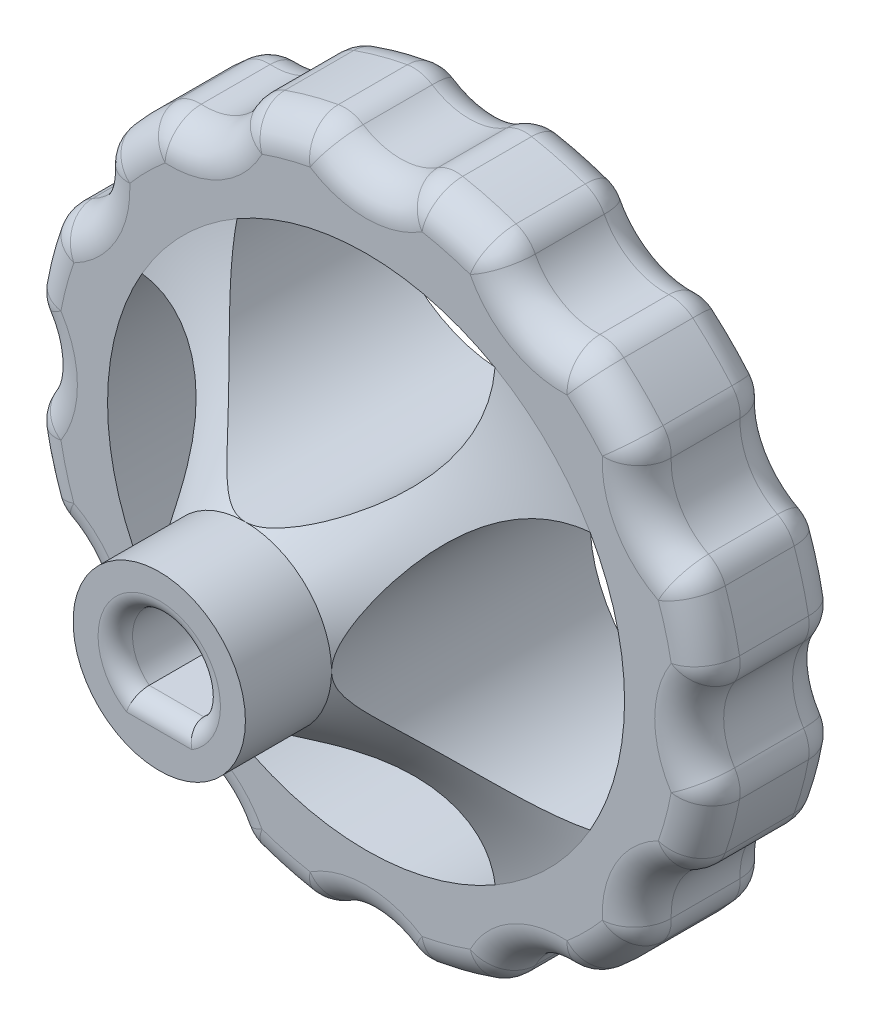
from build123d import *

# Parameters (mm, degrees)
CUT_EXTRUDE1_DEPTH = 35.641016151
CIRPATTERN1_COUNT  = 4
CUT_EXTRUDE3_DEPTH = 10
SKETCH7_R          = 4
CUT_EXTRUDE2_DEPTH = 35.641016151
CIRPATTERN2_COUNT  = 12
FILLET1_R          = 2
FILLET2_R          = 2
FILLET3_R          = 1


with BuildPart() as part:
    # Sketch1 → Revolve3 (revolve)
    with BuildSketch(Plane(origin=(0, 0, 0), x_dir=(0, 0, -1), z_dir=(1, 0, 0)), mode=Mode.PRIVATE) as revolve3_sk:
        with BuildLine():
            Line((0, 0), (0, 5))
            Line((0, 5), (5, 5))
            ThreePointArc((5, 5), (9.563207702, 9.255754609), (12, 15))
            Line((12, 15), (12, 20))
            Line((12, 20), (20, 20))
            Line((20, 20), (20, 0))
            Line((20, 0), (0, 0))
        make_face()
    revolve(revolve3_sk.sketch.rotate(Axis((0, 0, 0), (0, 0, -1)), 90), axis=Axis((0, 0, 0), (0, 0, -1)))

    # Sketch5 → Cut-Extrude1 (cut, through all)
    with BuildSketch(Plane(origin=(0, 0, -20), x_dir=(-1, 0, 0), z_dir=(0, 0, -1))):
        with BuildLine():
            ThreePointArc((7.483314774, 13), (0, 15), (-7.483314774, 13))
            ThreePointArc((-7.483314774, 13), (0, 5), (7.483314774, 13))
        make_face()
    cut_extrude1 = extrude(amount=-CUT_EXTRUDE1_DEPTH, mode=Mode.SUBTRACT)

    # CirPattern1: Cut-Extrude1 ×4 about axis
    cirpattern1_axis = Axis((0, 0, 0), (0, 0, 1))
    for i in range(1, CIRPATTERN1_COUNT):
        add(cut_extrude1.rotate(cirpattern1_axis, i * 360 / CIRPATTERN1_COUNT), mode=Mode.SUBTRACT)

    # Sketch6 → Cut-Extrude3 (cut)
    with BuildSketch(Plane.XY):
        with BuildLine():
            Line((1.581929202, -2), (-1.581929202, -2))
            ThreePointArc((-1.581929202, -2), (0, 2.55), (1.581929202, -2))
        make_face()
    extrude(amount=-CUT_EXTRUDE3_DEPTH, mode=Mode.SUBTRACT)

    # Sketch7 → Cut-Extrude2 (cut, through all)
    with BuildSketch(Plane(origin=(0, 0, -20), x_dir=(-1, 0, 0), z_dir=(0, 0, -1))):
        with Locations((0, -22.75)):
            Circle(SKETCH7_R)
    cut_extrude2 = extrude(amount=-CUT_EXTRUDE2_DEPTH, mode=Mode.SUBTRACT)

    # CirPattern2: Cut-Extrude2 ×12 about axis
    cirpattern2_axis = Axis((0, 0, 0), (0, 0, 1))
    for i in range(1, CIRPATTERN2_COUNT):
        add(cut_extrude2.rotate(cirpattern2_axis, i * 360 / CIRPATTERN2_COUNT), mode=Mode.SUBTRACT)

    # Fillet1
    fillet1_edges = [part.edges().sort_by_distance(p)[0] for p in [
        (-15.801310981, -12.260447434, -16),
        (-18.51851443, -7.554113005, -16),
        (-19.81456044, -2.71720345, -16),
        (-19.81456044, 2.71720345, -16),
        (-18.51851443, 7.554113005, -16),
        (-15.801310981, 12.260447434, -16),
        (-12.260447434, 15.801310981, -16),
        (-7.554113005, 18.51851443, -16),
        (-2.71720345, 19.81456044, -16),
        (2.71720345, 19.81456044, -16),
        (7.554113005, 18.51851443, -16),
        (12.260447434, 15.801310981, -16),
        (15.801310981, 12.260447434, -16),
        (18.51851443, 7.554113005, -16),
        (19.81456044, 2.71720345, -16),
        (19.81456044, -2.71720345, -16),
        (18.51851443, -7.554113005, -16),
        (15.801310981, -12.260447434, -16),
        (12.260447434, -15.801310981, -16),
        (7.554113005, -18.51851443, -16),
        (-7.554113005, -18.51851443, -16),
        (-12.260447434, -15.801310981, -16),
        (2.71720345, -19.81456044, -16),
        (-2.71720345, -19.81456044, -16),
    ]]
    fillet(fillet1_edges, radius=FILLET1_R)

    # Fillet2
    fillet2_edges = [part.edges().sort_by_distance(p)[0] for p in [
        (-9.375, 16.237976321, -12),
        (-7.357152839, 18.461463757, -12),
        (-12.309520185, 15.602213137, -12),
        (-5.176380902, 19.318516526, -12),
        (-14.142135624, 14.142135624, -12),
        (-2.85925062, 19.666673025, -12),
        (-15.602213137, 12.309520185, -12),
        (0, 18.75, -12),
        (-16.237976321, 9.375, -12),
        (2.85925062, 19.666673025, -12),
        (-18.461463757, 7.35715284, -12),
        (5.176380902, 19.318516526, -12),
        (-19.318516526, 5.176380902, -12),
        (7.35715284, 18.461463757, -12),
        (-19.666673025, 2.85925062, -12),
        (9.375, 16.237976321, -12),
        (-18.75, 0, -12),
        (12.309520185, 15.602213137, -12),
        (-19.666673025, -2.85925062, -12),
        (14.142135624, 14.142135624, -12),
        (-19.318516526, -5.176380902, -12),
        (15.602213137, 12.309520185, -12),
        (-18.461463757, -7.357152839, -12),
        (16.237976321, 9.375, -12),
        (-16.237976321, -9.375, -12),
        (18.461463757, 7.357152839, -12),
        (-15.602213137, -12.309520185, -12),
        (19.318516526, 5.176380902, -12),
        (-14.142135624, -14.142135624, -12),
        (19.666673025, 2.85925062, -12),
        (-12.309520185, -15.602213137, -12),
        (18.75, 0, -12),
        (-9.375, -16.237976321, -12),
        (19.666673025, -2.85925062, -12),
        (-7.35715284, -18.461463757, -12),
        (19.318516526, -5.176380902, -12),
        (-5.176380902, -19.318516526, -12),
        (18.461463757, -7.35715284, -12),
        (-2.85925062, -19.666673025, -12),
        (16.237976321, -9.375, -12),
        (0, -18.75, -12),
        (15.602213137, -12.309520185, -12),
        (2.85925062, -19.666673025, -12),
        (14.142135624, -14.142135624, -12),
        (5.176380902, -19.318516526, -12),
        (12.309520185, -15.602213137, -12),
        (7.357152839, -18.461463757, -12),
        (9.375, -16.237976321, -12),
    ]]
    fillet(fillet2_edges, radius=FILLET2_R - 0.0004)  # a hair under: the kernel refuses the full size
    fillet2_2_edges = [part.edges().sort_by_distance(p)[0] for p in [
        (-9.375, 16.237976321, -20),
        (-7.357152839, 18.461463757, -20),
        (-12.309520185, 15.602213137, -20),
        (-5.176380902, 19.318516526, -20),
        (-14.142135624, 14.142135624, -20),
        (-2.85925062, 19.666673025, -20),
        (-15.602213137, 12.309520185, -20),
        (0, 18.75, -20),
        (-16.237976321, 9.375, -20),
        (2.85925062, 19.666673025, -20),
        (-18.461463757, 7.35715284, -20),
        (5.176380902, 19.318516526, -20),
        (-19.318516526, 5.176380902, -20),
        (7.35715284, 18.461463757, -20),
        (-19.666673025, 2.85925062, -20),
        (9.375, 16.237976321, -20),
        (-18.75, 0, -20),
        (12.309520185, 15.602213137, -20),
        (-19.666673025, -2.85925062, -20),
        (14.142135624, 14.142135624, -20),
        (-19.318516526, -5.176380902, -20),
        (15.602213137, 12.309520185, -20),
        (-18.461463757, -7.357152839, -20),
        (16.237976321, 9.375, -20),
        (-16.237976321, -9.375, -20),
        (18.461463757, 7.357152839, -20),
        (-15.602213137, -12.309520185, -20),
        (19.318516526, 5.176380902, -20),
        (-14.142135624, -14.142135624, -20),
        (19.666673025, 2.85925062, -20),
        (-12.309520185, -15.602213137, -20),
        (18.75, 0, -20),
        (-9.375, -16.237976321, -20),
        (19.666673025, -2.85925062, -20),
        (-7.35715284, -18.461463757, -20),
        (19.318516526, -5.176380902, -20),
        (-5.176380902, -19.318516526, -20),
        (18.461463757, -7.35715284, -20),
        (-2.85925062, -19.666673025, -20),
        (16.237976321, -9.375, -20),
        (0, -18.75, -20),
        (15.602213137, -12.309520185, -20),
        (2.85925062, -19.666673025, -20),
        (14.142135624, -14.142135624, -20),
        (5.176380902, -19.318516526, -20),
        (12.309520185, -15.602213137, -20),
        (7.357152839, -18.461463757, -20),
        (9.375, -16.237976321, -20),
    ]]
    fillet(fillet2_2_edges, radius=FILLET2_R - 0.0004)  # a hair under: the kernel refuses the full size

    # Fillet3
    fillet3_edges = [part.edges().sort_by_distance(p)[0] for p in [
        (0, 2.55, 0),
        (0, -2, 0),
    ]]
    fillet(fillet3_edges, radius=FILLET3_R)


solid = part.part
